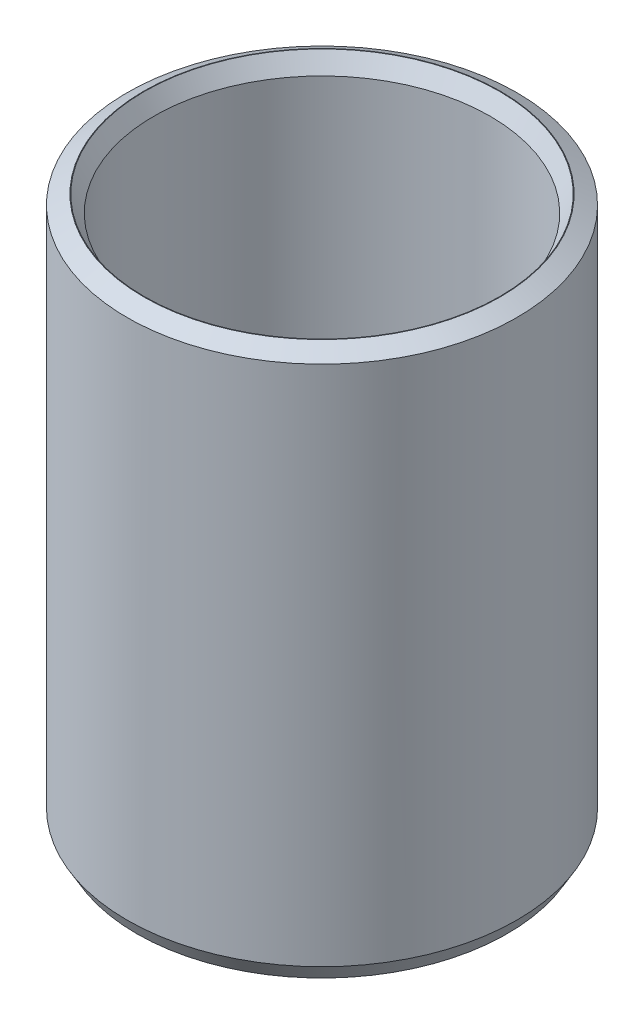
from build123d import *
from OCP.BRepFilletAPI import BRepFilletAPI_MakeChamfer

# Parameters (mm, degrees)
SKETCH1_R           = 47.5
BOSS_EXTRUDE1_DEPTH = 133.582892005
SKETCH2_R           = 40.978543052
CUT_EXTRUDE1_DEPTH  = 150.522202487
CHAMFER1_SIZE       = 2.334323471
CHAMFER1_SIZE2      = 4.043166853


with BuildPart() as part:
    # Sketch1 → Boss-Extrude1 (new body)
    with BuildSketch(Plane(origin=(0, 0, 0), x_dir=(1, 0, 0), z_dir=(0, 1, 0))):
        Circle(SKETCH1_R)
    extrude(amount=BOSS_EXTRUDE1_DEPTH)

    # Sketch2 → Cut-Extrude1 (cut, through all)
    with BuildSketch(Plane(origin=(0, 0, 0), x_dir=(1, 0, 0), z_dir=(0, 1, 0))):
        Circle(SKETCH2_R)
    extrude(amount=CUT_EXTRUDE1_DEPTH, mode=Mode.SUBTRACT)

    # Chamfer1: one chamfer whose edges measure the first distance from different faces: ONE call of the kernel's chamfer builder (chamfer() names one face for all edges)
    chamfer1_edges_1 = [part.edges().sort_by_distance(p)[0] for p in [
        (-40.978543052, 133.582892005, 0),
    ]]
    chamfer1_side_1 = [part.faces().sort_by_distance(p)[0] for p in [
        (-46.156497116, 133.582892005, 0),
    ]]
    chamfer1_edges_2 = [part.edges().sort_by_distance(p)[0] for p in [
        (-40.978543052, 0, 0),
    ]]
    chamfer1_side_2 = [part.faces().sort_by_distance(p)[0] for p in [
        (-40.978543052, 66.791446003, 0),
    ]]
    chamfer1_edges_3 = [part.edges().sort_by_distance(p)[0] for p in [
        (-47.5, 0, 0),
    ]]
    chamfer1_side_3 = [part.faces().sort_by_distance(p)[0] for p in [
        (-46.156497116, 0, 0),
    ]]
    chamfer1_edges_4 = [part.edges().sort_by_distance(p)[0] for p in [
        (-47.5, 133.582892005, 0),
    ]]
    chamfer1_side_4 = [part.faces().sort_by_distance(p)[0] for p in [
        (-47.5, 66.791446003, 0),
    ]]
    chamfer1 = BRepFilletAPI_MakeChamfer(part.part.solid().wrapped)
    for e in chamfer1_edges_1:
        chamfer1.Add(CHAMFER1_SIZE, CHAMFER1_SIZE2, e.wrapped, chamfer1_side_1[0].wrapped)  # the first distance lies on this face
    for e in chamfer1_edges_2:
        chamfer1.Add(CHAMFER1_SIZE, CHAMFER1_SIZE2, e.wrapped, chamfer1_side_2[0].wrapped)  # the first distance lies on this face
    for e in chamfer1_edges_3:
        chamfer1.Add(CHAMFER1_SIZE, CHAMFER1_SIZE2, e.wrapped, chamfer1_side_3[0].wrapped)  # the first distance lies on this face
    for e in chamfer1_edges_4:
        chamfer1.Add(CHAMFER1_SIZE, CHAMFER1_SIZE2, e.wrapped, chamfer1_side_4[0].wrapped)  # the first distance lies on this face
    add(Compound.cast(chamfer1.Shape()), mode=Mode.REPLACE)


solid = part.part
